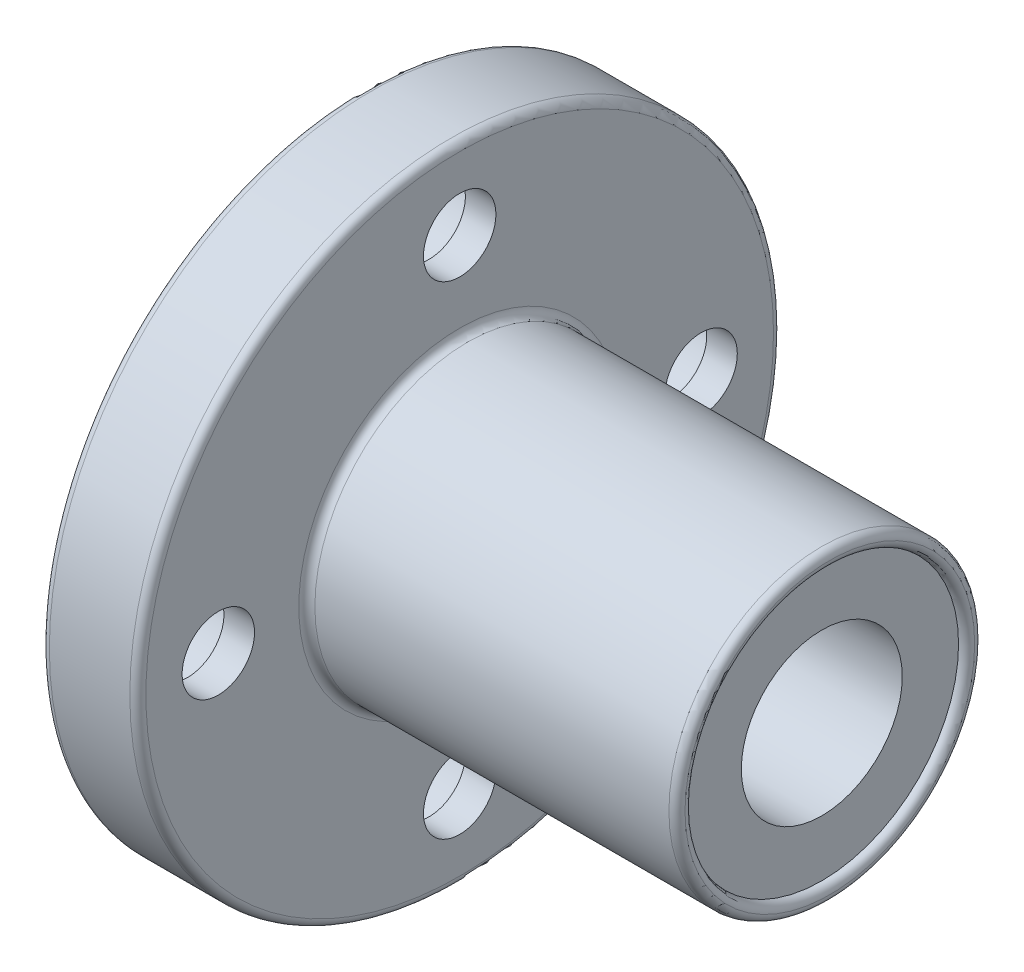
from build123d import *

# Parameters (mm, degrees)
IZIM1_R                     = 20
IZIM1_R_2                   = 9.5
IZIM1_R_3                   = 5
Y_KSEKLIK_EKSTR_ZYON1_DEPTH = 6
IZIM1_4_R                   = 9.5
IZIM1_4_R_2                 = 5
Y_KSEKLIK_EKSTR_ZYON2_DEPTH = 29
IZIM2_R                     = 2.25
KES_EKSTR_ZYON5_DEPTH       = 14.1
IZIM2_6_R                   = 3.75
IZIM2_6_R_2                 = 2.25
KES_EKSTR_ZYON6_DEPTH       = 4.1
IZIM3_R                     = 8.5
KES_EKSTR_ZYON7_DEPTH       = 0.5
RADYUS1_R                   = 0.5


with BuildPart() as part:
    # Çizim1 → Yükseklik-Ekstrüzyon1 (new body)
    # profile 1 of 2: a face of its own
    with BuildSketch(Plane(origin=(0, 0, 0), x_dir=(0, 0, -1), z_dir=(1, 0, 0))):
        Circle(IZIM1_R)
        Circle(IZIM1_R_2, mode=Mode.SUBTRACT)
    # profile 2 of 2: a face of its own
    with BuildSketch(Plane(origin=(0, 0, 0), x_dir=(0, 0, -1), z_dir=(1, 0, 0))):
        Circle(IZIM1_R_2)
        Circle(IZIM1_R_3, mode=Mode.SUBTRACT)
    extrude(amount=Y_KSEKLIK_EKSTR_ZYON1_DEPTH)

    # Çizim1<4> → Yükseklik-Ekstrüzyon2 (add)
    with BuildSketch(Plane(origin=(0, 0, 0), x_dir=(0, 0, -1), z_dir=(1, 0, 0))):
        with Locations(Location((0, 0, 0), (0, 0, 180))):
            Circle(IZIM1_4_R)
        Circle(IZIM1_4_R_2, mode=Mode.SUBTRACT)
    extrude(amount=Y_KSEKLIK_EKSTR_ZYON2_DEPTH)

    # Çizim2 → Kes-Ekstrüzyon5 (cut)
    with BuildSketch(Plane.ZY):
        with Locations((0, 15)):
            Circle(IZIM2_R)
        with Locations((15, 0)):
            Circle(IZIM2_R)
        with Locations((0, -15)):
            Circle(IZIM2_R)
        with Locations((-15, 0)):
            Circle(IZIM2_R)
    extrude(amount=-KES_EKSTR_ZYON5_DEPTH, mode=Mode.SUBTRACT)

    # Çizim2<6> → Kes-Ekstrüzyon6 (cut)
    # profile 1 of 4: a face of its own
    with BuildSketch(Plane.ZY):
        with Locations((0, 15)):
            Circle(IZIM2_6_R)
        with Locations((0, 15)):
            Circle(IZIM2_6_R_2, mode=Mode.SUBTRACT)
    # profile 2 of 4: a face of its own
    with BuildSketch(Plane.ZY):
        with Locations((15, 0)):
            Circle(IZIM2_6_R)
        with Locations((15, 0)):
            Circle(IZIM2_6_R_2, mode=Mode.SUBTRACT)
    # profile 3 of 4: a face of its own
    with BuildSketch(Plane.ZY):
        with Locations((0, -15)):
            Circle(IZIM2_6_R)
        with Locations((0, -15)):
            Circle(IZIM2_6_R_2, mode=Mode.SUBTRACT)
    # profile 4 of 4: a face of its own
    with BuildSketch(Plane.ZY):
        with Locations((-15, 0)):
            Circle(IZIM2_6_R)
        with Locations((-15, 0)):
            Circle(IZIM2_6_R_2, mode=Mode.SUBTRACT)
    extrude(amount=-KES_EKSTR_ZYON6_DEPTH, mode=Mode.SUBTRACT)

    # Çizim3 → Kes-Ekstrüzyon7 (cut)
    with BuildSketch(Plane(origin=(29, 0, 0), x_dir=(0, 0, -1), z_dir=(1, 0, 0))):
        Circle(IZIM3_R)
    kes_ekstr_zyon7 = extrude(amount=-KES_EKSTR_ZYON7_DEPTH, mode=Mode.SUBTRACT)

    # Radyus1
    radyus1_edges = [part.edges().sort_by_distance(p)[0] for p in [
        (6, 0, -9.5),
        (29, 0, -9.5),
        (0, 0, 20),
        (6, 0, 20),
        (29, 0, 8.5),
    ]]
    fillet(radyus1_edges, radius=RADYUS1_R - 0.0001)  # a hair under: the kernel refuses the full size

    # Aynalama1: Kes-Ekstrüzyon7 across plane
    add(kes_ekstr_zyon7.mirror(Plane(origin=(14.5, 0, 0), x_dir=(0, 0, 1), z_dir=(1, 0, 0))), mode=Mode.SUBTRACT)


solid = part.part
